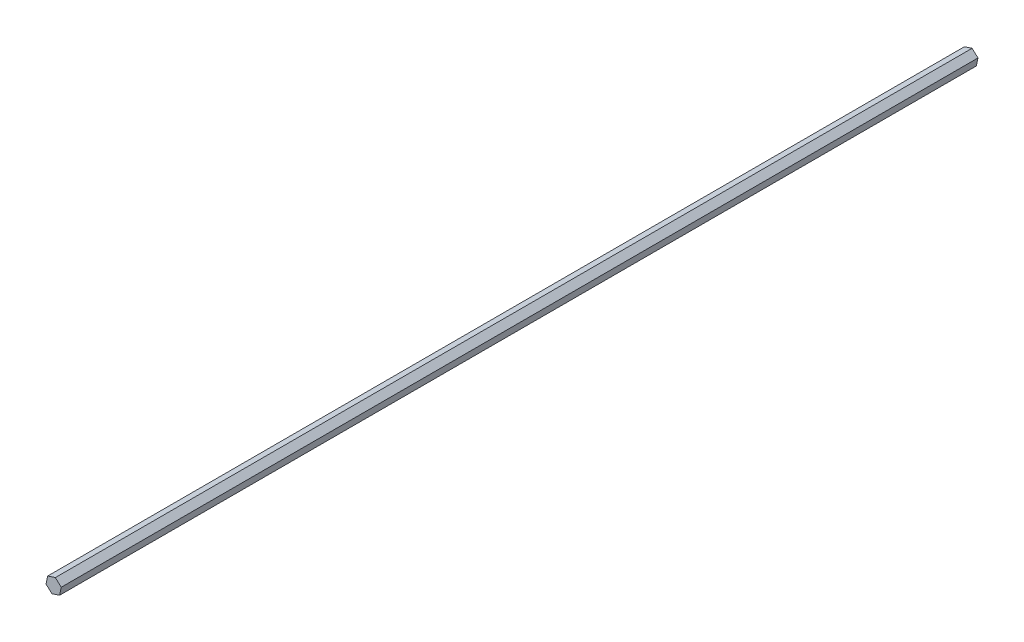
from build123d import *

# Parameters (mm, degrees)
BOSS_EXTRUDE1_DEPTH = 330.2


with BuildPart() as part:
    # Sketch1 → Boss-Extrude1 (new body)
    with BuildSketch(Plane.XY):
        Polygon((2.137295047, -1.940438924), (2.749116926, 0.880732344), (0.611821879, 2.821171268), (-2.137295047, 1.940438924), (-2.749116926, -0.880732344), (-0.611821879, -2.821171268), align=None)
    extrude(amount=BOSS_EXTRUDE1_DEPTH)


solid = part.part
